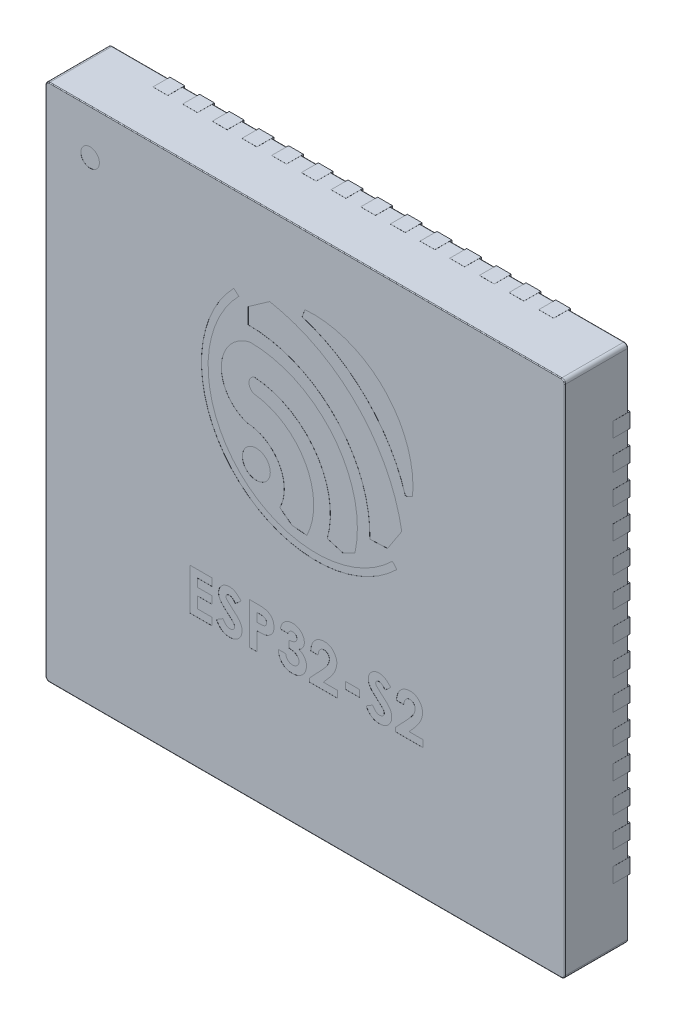
from build123d import *

# Parameters (mm, degrees)
SKETCH1_W                = 7
SKETCH1_H                = 7
BOSS_EXTRUDE1_DEPTH      = 0.85
FILLET1_R                = 0.05
FILLET2_R                = 0.01
BOSS_EXTRUDE2_DEPTH      = 0.025
BOSS_EXTRUDE2_DEPTH_BACK = 0.203
SKETCH2_W                = 0.2
SKETCH2_H                = 0.4
SKETCH2_W_2              = 0.4
SKETCH2_H_2              = 0.2
SKETCH3_R                = 0.125
SKETCH3_R_2              = 0.188076001
SKETCH3_W                = 0.193846154
SKETCH3_H                = 0.093333333
CUT_EXTRUDE1_DEPTH       = 0.001
BODY_MOVE_COPY1_ANGLE    = 180


with BuildPart() as part:
    # Sketch1 → Boss-Extrude1 (new body)
    with BuildSketch(Plane(origin=(0, 0, 0), x_dir=(1, 0, 0), z_dir=(0, 1, 0))):
        Rectangle(SKETCH1_W, SKETCH1_H)
    extrude(amount=BOSS_EXTRUDE1_DEPTH)

    # Fillet1
    fillet1_edges = [part.edges().sort_by_distance(p)[0] for p in [
        (3.5, 0.425, -3.5),
        (3.5, 0.425, 3.5),
        (-3.5, 0.425, 3.5),
        (-3.5, 0.425, -3.5),
    ]]
    fillet(fillet1_edges, radius=FILLET1_R)

    # Fillet2
    fillet2_edges = [part.edges().sort_by_distance(p)[0] for p in [
        (3.485355339, 0.85, 3.485355339),
        (0, 0.85, 3.5),
        (-3.485355339, 0.85, 3.485355339),
        (-3.5, 0.85, 0),
        (-3.485355339, 0.85, -3.485355339),
        (0, 0.85, -3.5),
        (3.485355339, 0.85, -3.485355339),
        (3.5, 0.85, 0),
        (3.5, 0, 0),
        (3.485355339, 0, -3.485355339),
        (0, 0, -3.5),
        (3.485355339, 0, 3.485355339),
        (0, 0, 3.5),
        (-3.485355339, 0, 3.485355339),
        (-3.5, 0, 0),
        (-3.485355339, 0, -3.485355339),
    ]]
    fillet(fillet2_edges, radius=FILLET2_R)

    # Sketch2 → Boss-Extrude2 (add, two sides: drawn at the far end of the back side and taken through both)
    with BuildSketch(Plane.XZ.offset(-BOSS_EXTRUDE2_DEPTH_BACK)):
        with BuildLine():
            Line((1.5, 2), (2, 1.5))
            Line((2, 1.5), (2, -1.875))
            ThreePointArc((2, -1.875), (1.963388348, -1.963388348), (1.875, -2))
            Line((1.875, -2), (-1.875, -2))
            ThreePointArc((-1.875, -2), (-1.963388348, -1.963388348), (-2, -1.875))
            Line((-2, -1.875), (-2, 1.875))
            ThreePointArc((-2, 1.875), (-1.963388348, 1.963388348), (-1.875, 2))
            Line((-1.875, 2), (1.5, 2))
        make_face()
        with Locations((-1.8, 3.301)):
            Rectangle(SKETCH2_W, SKETCH2_H)
        with Locations((-0.2, 3.301)):
            Rectangle(SKETCH2_W, SKETCH2_H)
        with Locations((-0.6, 3.301)):
            Rectangle(SKETCH2_W, SKETCH2_H)
        with Locations((-1, 3.301)):
            Rectangle(SKETCH2_W, SKETCH2_H)
        with Locations((-1.4, 3.301)):
            Rectangle(SKETCH2_W, SKETCH2_H)
        with Locations((-2.2, 3.301)):
            Rectangle(SKETCH2_W, SKETCH2_H)
        with Locations((-2.6, 3.301)):
            Rectangle(SKETCH2_W, SKETCH2_H)
        with Locations((2.6, 3.301)):
            Rectangle(SKETCH2_W, SKETCH2_H)
        with Locations((2.2, 3.301)):
            Rectangle(SKETCH2_W, SKETCH2_H)
        with Locations((1.8, 3.301)):
            Rectangle(SKETCH2_W, SKETCH2_H)
        with Locations((1.4, 3.301)):
            Rectangle(SKETCH2_W, SKETCH2_H)
        with Locations((1, 3.301)):
            Rectangle(SKETCH2_W, SKETCH2_H)
        with Locations((0.6, 3.301)):
            Rectangle(SKETCH2_W, SKETCH2_H)
        with Locations((0.2, 3.301)):
            Rectangle(SKETCH2_W, SKETCH2_H)
        with Locations((1.8, -3.301)):
            Rectangle(SKETCH2_W, SKETCH2_H)
        with Locations((0.2, -3.301)):
            Rectangle(SKETCH2_W, SKETCH2_H)
        with Locations((0.6, -3.301)):
            Rectangle(SKETCH2_W, SKETCH2_H)
        with Locations((1, -3.301)):
            Rectangle(SKETCH2_W, SKETCH2_H)
        with Locations((1.4, -3.301)):
            Rectangle(SKETCH2_W, SKETCH2_H)
        with Locations((2.2, -3.301)):
            Rectangle(SKETCH2_W, SKETCH2_H)
        with Locations((2.6, -3.301)):
            Rectangle(SKETCH2_W, SKETCH2_H)
        with Locations((-2.6, -3.301)):
            Rectangle(SKETCH2_W, SKETCH2_H)
        with Locations((-2.2, -3.301)):
            Rectangle(SKETCH2_W, SKETCH2_H)
        with Locations((-1.8, -3.301)):
            Rectangle(SKETCH2_W, SKETCH2_H)
        with Locations((-1.4, -3.301)):
            Rectangle(SKETCH2_W, SKETCH2_H)
        with Locations((-1, -3.301)):
            Rectangle(SKETCH2_W, SKETCH2_H)
        with Locations((-0.6, -3.301)):
            Rectangle(SKETCH2_W, SKETCH2_H)
        with Locations((-0.2, -3.301)):
            Rectangle(SKETCH2_W, SKETCH2_H)
        with Locations((3.301, 1.8)):
            Rectangle(SKETCH2_W_2, SKETCH2_H_2)
        with Locations((3.301, 0.2)):
            Rectangle(SKETCH2_W_2, SKETCH2_H_2)
        with Locations((3.301, 0.6)):
            Rectangle(SKETCH2_W_2, SKETCH2_H_2)
        with Locations((3.301, 1)):
            Rectangle(SKETCH2_W_2, SKETCH2_H_2)
        with Locations((3.301, 1.4)):
            Rectangle(SKETCH2_W_2, SKETCH2_H_2)
        with Locations((3.301, 2.2)):
            Rectangle(SKETCH2_W_2, SKETCH2_H_2)
        with Locations((3.301, 2.6)):
            Rectangle(SKETCH2_W_2, SKETCH2_H_2)
        with Locations((3.301, -2.6)):
            Rectangle(SKETCH2_W_2, SKETCH2_H_2)
        with Locations((3.301, -2.2)):
            Rectangle(SKETCH2_W_2, SKETCH2_H_2)
        with Locations((3.301, -1.8)):
            Rectangle(SKETCH2_W_2, SKETCH2_H_2)
        with Locations((3.301, -1.4)):
            Rectangle(SKETCH2_W_2, SKETCH2_H_2)
        with Locations((3.301, -1)):
            Rectangle(SKETCH2_W_2, SKETCH2_H_2)
        with Locations((3.301, -0.6)):
            Rectangle(SKETCH2_W_2, SKETCH2_H_2)
        with Locations((3.301, -0.2)):
            Rectangle(SKETCH2_W_2, SKETCH2_H_2)
        with Locations((-3.301, -1.8)):
            Rectangle(SKETCH2_W_2, SKETCH2_H_2)
        with Locations((-3.301, -0.2)):
            Rectangle(SKETCH2_W_2, SKETCH2_H_2)
        with Locations((-3.301, -0.6)):
            Rectangle(SKETCH2_W_2, SKETCH2_H_2)
        with Locations((-3.301, -1)):
            Rectangle(SKETCH2_W_2, SKETCH2_H_2)
        with Locations((-3.301, -1.4)):
            Rectangle(SKETCH2_W_2, SKETCH2_H_2)
        with Locations((-3.301, -2.2)):
            Rectangle(SKETCH2_W_2, SKETCH2_H_2)
        with Locations((-3.301, -2.6)):
            Rectangle(SKETCH2_W_2, SKETCH2_H_2)
        with Locations((-3.301, 2.6)):
            Rectangle(SKETCH2_W_2, SKETCH2_H_2)
        with Locations((-3.301, 2.2)):
            Rectangle(SKETCH2_W_2, SKETCH2_H_2)
        with Locations((-3.301, 1.8)):
            Rectangle(SKETCH2_W_2, SKETCH2_H_2)
        with Locations((-3.301, 1.4)):
            Rectangle(SKETCH2_W_2, SKETCH2_H_2)
        with Locations((-3.301, 1)):
            Rectangle(SKETCH2_W_2, SKETCH2_H_2)
        with Locations((-3.301, 0.6)):
            Rectangle(SKETCH2_W_2, SKETCH2_H_2)
        with Locations((-3.301, 0.2)):
            Rectangle(SKETCH2_W_2, SKETCH2_H_2)
    extrude(amount=BOSS_EXTRUDE2_DEPTH + BOSS_EXTRUDE2_DEPTH_BACK)

    # Sketch3 → Cut-Extrude1 (cut)
    # profile 1 of 14: a face of its own
    with BuildSketch(Plane(origin=(0, 0.85, 0), x_dir=(1, 0, 0), z_dir=(0, 1, 0))):
        with Locations((2.9, -2.9)):
            Circle(SKETCH3_R)
    # profile 2 of 14: a face of its own
    with BuildSketch(Plane(origin=(0, 0.85, 0), x_dir=(1, 0, 0), z_dir=(0, 1, 0))):
        with Locations((0.659982778, -0.439394297)):
            Circle(SKETCH3_R_2)
    # profile 3 of 14: a face of its own
    with BuildSketch(Plane(origin=(0, 0.85, 0), x_dir=(1, 0, 0), z_dir=(0, 1, 0))):
        with BuildLine():
            Line((-1.349549222, -1.072318121), (-1.446191222, -1.113478121))
            ThreePointArc((-1.446191222, -1.113478121), (-1.059880086, -2.180396862), (0.005032916, -2.572203181))
            Line((0.005032916, -2.572203181), (0.041868778, -2.469532121))
            ThreePointArc((0.041868778, -2.469532121), (-0.82803159, -1.944393898), (-1.349549222, -1.072318121))
        make_face()
    # profile 4 of 14: a face of its own
    with BuildSketch(Plane(origin=(0, 0.85, 0), x_dir=(1, 0, 0), z_dir=(0, 1, 0))):
        with BuildLine():
            Line((-0.869489223, -0.330470994), (-1.107671223, -0.340676994))
            Line((-1.107671223, -0.340676994), (-1.300157223, -0.634550994))
            ThreePointArc((-1.300157223, -0.634550994), (-0.692450735, -1.812086189), (0.480463515, -2.428664221))
            Line((0.480463515, -2.428664221), (0.769423515, -2.225930221))
            Line((0.769423515, -2.225930221), (0.769423515, -2.012948221))
            ThreePointArc((0.769423515, -2.012948221), (-0.40545634, -1.517930091), (-0.869489223, -0.330470994))
        make_face()
    # profile 5 of 14: a face of its own
    with BuildSketch(Plane(origin=(0, 0.85, 0), x_dir=(1, 0, 0), z_dir=(0, 1, 0))):
        with BuildLine():
            Line((0.896022778, -2.282632121), (0.963348778, -2.342188121))
            ThreePointArc((0.963348778, -2.342188121), (0.942387371, -0.165304228), (-1.234585284, -0.158029423))
            Line((-1.234585284, -0.158029423), (-1.174711499, -0.22508253))
            ThreePointArc((-1.174711499, -0.22508253), (0.879043915, -0.228943263), (0.896022778, -2.282632121))
        make_face()
    # profile 6 of 14: a face of its own
    with BuildSketch(Plane(origin=(0, 0.85, 0), x_dir=(1, 0, 0), z_dir=(0, 1, 0))):
        with BuildLine():
            Line((0.343768142, -0.092368262), (0.178036142, 0.033043738))
            Line((0.178036142, 0.033043738), (-0.020959858, 0.050557738))
            ThreePointArc((-0.020959858, 0.050557738), (-0.002822317, -0.781738392), (0.688714571, -1.245227928))
            ThreePointArc((0.688714571, -1.245227928), (0.759117615, -1.345326882), (0.684998991, -1.442706649))
            ThreePointArc((0.684998991, -1.442706649), (-0.138631273, -0.981739844), (-0.295638342, -0.051037964))
            Line((-0.295638342, -0.051037964), (-0.505974342, 0.011584036))
            Line((-0.505974342, 0.011584036), (-0.669841509, -0.070433453))
            ThreePointArc((-0.669841509, -0.070433453), (-0.380757465, -1.284591547), (0.745289658, -1.822891964))
            ThreePointArc((0.745289658, -1.822891964), (1.131651248, -1.357713211), (0.786573986, -0.861136696))
            ThreePointArc((0.786573986, -0.861136696), (0.353817857, -0.598490614), (0.343768142, -0.092368262))
        make_face()
    # profile 7 of 14: a face of its own
    with BuildSketch(Plane(origin=(0, 0.85, 0), x_dir=(1, 0, 0), z_dir=(0, 1, 0))):
        with BuildLine():
            Line((-1.329615385, 1.371666667), (-1.229102564, 1.371666667))
            add(Edge.make_bspline(
                [(-1.229102564, 1.371666667), (-1.229536493, 1.364063324), (-1.230384364, 1.349206849), (-1.233760681, 1.327628677), (-1.238273205, 1.307234689), (-1.244347173, 1.288086197), (-1.251828628, 1.270175155), (-1.260903774, 1.253560894), (-1.271301659, 1.238124364), (-1.283231873, 1.224136291), (-1.296210226, 1.211560588), (-1.310203445, 1.200566579), (-1.325171782, 1.191363155), (-1.341015146, 1.183813544), (-1.357671306, 1.177772883), (-1.37530855, 1.173736339), (-1.393771251, 1.17100216), (-1.406410578, 1.170762947), (-1.412852564, 1.170641026)],
                knots=[0, 0, 0, 0, 1.198928049, 2.342633425, 3.435730849, 4.486331048, 5.502589352, 6.488331875, 7.46361919, 8.428949135, 9.378681775, 10.305958057, 11.226249248, 12.140413166, 13.066341608, 14.010670971, 14.986082777, 16, 16, 16, 16], degree=3))
            add(Edge.make_bspline(
                [(-1.412852564, 1.170641026), (-1.420763388, 1.170871577), (-1.436213955, 1.171321865), (-1.458593158, 1.175657307), (-1.479626905, 1.182335589), (-1.499107339, 1.191940864), (-1.516932362, 1.204108445), (-1.532890071, 1.218771945), (-1.547053705, 1.235751496), (-1.558956337, 1.254922995), (-1.56863749, 1.27529442), (-1.575627503, 1.296236112), (-1.58016763, 1.317325828), (-1.580655213, 1.331521527), (-1.580897436, 1.338573718)],
                knots=[0, 0, 0, 0, 1.075206757, 2.099977874, 3.089436832, 4.070080219, 5.043757236, 6.01602434, 7.009399377, 8.042659726, 9.078134622, 10.07077983, 11.041594984, 12, 12, 12, 12], degree=3))
            add(Edge.make_bspline(
                [(-1.580897436, 1.338573718), (-1.580803484, 1.342839629), (-1.580614383, 1.351425853), (-1.579299535, 1.364418918), (-1.577327003, 1.377653874), (-1.574352904, 1.391119373), (-1.570643964, 1.404819191), (-1.566144468, 1.418794317), (-1.560750116, 1.432965562), (-1.554550661, 1.447492238), (-1.547155589, 1.462422243), (-1.538541381, 1.477976354), (-1.528470343, 1.49419737), (-1.517040798, 1.511034789), (-1.50433326, 1.52861919), (-1.490154305, 1.546742314), (-1.474685532, 1.565608767), (-1.463703291, 1.578217479), (-1.458060897, 1.584695513)],
                knots=[0, 0, 0, 0, 0.728286467, 1.465860763, 2.227952348, 3.011875114, 3.818782069, 4.650637576, 5.517456182, 6.406927181, 7.346324104, 8.360844784, 9.441645378, 10.605053135, 11.834886952, 13.145197974, 14.533275831, 16, 16, 16, 16], degree=3))
            Line((-1.458060897, 1.584695513), (-1.399615385, 1.651666667))
            Line((-1.399615385, 1.651666667), (-1.588076923, 1.651666667))
            Line((-1.588076923, 1.651666667), (-1.588076923, 1.745))
            Line((-1.588076923, 1.745), (-1.21474359, 1.745))
            Line((-1.21474359, 1.745), (-1.21474359, 1.694070513))
            Line((-1.21474359, 1.694070513), (-1.380544872, 1.517612179))
            add(Edge.make_bspline(
                [(-1.380544872, 1.517612179), (-1.385345321, 1.512464886), (-1.394642368, 1.502496106), (-1.407869872, 1.487855055), (-1.419844, 1.473964046), (-1.430297013, 1.46066199), (-1.439861346, 1.448399276), (-1.447862614, 1.436712327), (-1.454830739, 1.425930269), (-1.462109681, 1.412787369), (-1.469181366, 1.397230513), (-1.475665988, 1.379319453), (-1.479579191, 1.362188601), (-1.480123495, 1.351005785), (-1.480384615, 1.345641026)],
                knots=[0, 0, 0, 0, 1.246192343, 2.413505005, 3.49357156, 4.492416076, 5.408771964, 6.246246772, 6.999304986, 7.680960093, 8.904522682, 10.020616941, 11.0504258, 12, 12, 12, 12], degree=3))
            add(Edge.make_bspline(
                [(-1.480384615, 1.345641026), (-1.480192938, 1.340449305), (-1.479821532, 1.330389515), (-1.475638343, 1.316121148), (-1.469379259, 1.303104564), (-1.460292256, 1.291932704), (-1.449324476, 1.282672272), (-1.436578092, 1.275886338), (-1.42228714, 1.271897924), (-1.412279615, 1.2714066), (-1.40713141, 1.271153846)],
                knots=[0, 0, 0, 0, 1.061596218, 2.057012874, 3.024113775, 4.006148568, 4.986025304, 5.949989669, 6.945406325, 8, 8, 8, 8], degree=3))
            add(Edge.make_bspline(
                [(-1.40713141, 1.271153846), (-1.404472307, 1.271247897), (-1.399237434, 1.271433052), (-1.391542581, 1.272665578), (-1.384220376, 1.274837775), (-1.377189318, 1.277748215), (-1.370524444, 1.281606023), (-1.364242566, 1.286361386), (-1.358277496, 1.291893459), (-1.352656592, 1.298184945), (-1.347540836, 1.305206245), (-1.34299704, 1.312893234), (-1.339240077, 1.321241141), (-1.33593231, 1.33013976), (-1.333381202, 1.339684669), (-1.331523679, 1.349818744), (-1.330111528, 1.360525498), (-1.329783774, 1.367885385), (-1.329615385, 1.371666667)],
                knots=[0, 0, 0, 0, 0.903469896, 1.778625579, 2.63899355, 3.493148037, 4.358286772, 5.247621495, 6.164656832, 7.118446693, 8.109501108, 9.111810964, 10.146451449, 11.215617525, 12.33435995, 13.498009769, 14.714554818, 16, 16, 16, 16], degree=3))
        make_face()
    # profile 8 of 14: a face of its own
    with BuildSketch(Plane(origin=(0, 0.85, 0), x_dir=(1, 0, 0), z_dir=(0, 1, 0))):
        with BuildLine():
            Line((-1.150128205, 1.259823718), (-1.074967949, 1.328589744))
            add(Edge.make_bspline(
                [(-1.074967949, 1.328589744), (-1.071749025, 1.324047432), (-1.065569141, 1.315326827), (-1.055542124, 1.303662479), (-1.045575011, 1.293646645), (-1.035464015, 1.285565689), (-1.025383215, 1.279060264), (-1.015118439, 1.274573211), (-1.004787777, 1.27168756), (-0.997843521, 1.271329977), (-0.994423077, 1.271153846)],
                knots=[0, 0, 0, 0, 1.299459705, 2.494781419, 3.587730629, 4.594196874, 5.512431013, 6.380462003, 7.202284646, 8, 8, 8, 8], degree=3))
            add(Edge.make_bspline(
                [(-0.994423077, 1.271153846), (-0.991231278, 1.271262401), (-0.985068752, 1.271471991), (-0.976324536, 1.273660135), (-0.96846638, 1.277196059), (-0.961703605, 1.282080374), (-0.956263099, 1.287913663), (-0.952032781, 1.294123483), (-0.949574535, 1.300894233), (-0.949258848, 1.305537731), (-0.949102564, 1.307836538)],
                knots=[0, 0, 0, 0, 1.184157716, 2.286297433, 3.324836695, 4.370048774, 5.362957217, 6.276446515, 7.146738784, 8, 8, 8, 8], degree=3))
            add(Edge.make_bspline(
                [(-0.949102564, 1.307836538), (-0.949201492, 1.310167416), (-0.949400718, 1.314861481), (-0.951324973, 1.321741217), (-0.954225375, 1.32846352), (-0.956996827, 1.332555705), (-0.958413462, 1.334647436)],
                knots=[0, 0, 0, 0, 0.967525499, 1.948461899, 2.951351359, 4, 4, 4, 4], degree=3))
            add(Edge.make_bspline(
                [(-0.958413462, 1.334647436), (-0.959706529, 1.336268479), (-0.962700198, 1.340021467), (-0.968235031, 1.346060545), (-0.975472159, 1.353150087), (-0.984105696, 1.361647315), (-0.994459644, 1.371222165), (-1.006311699, 1.382151867), (-1.019925554, 1.394065148), (-1.02946345, 1.402475381), (-1.034471154, 1.406891026)],
                knots=[0, 0, 0, 0, 0.473849886, 1.097042329, 1.870584189, 2.789244661, 3.865562256, 5.093556389, 6.47402294, 8, 8, 8, 8], degree=3))
            add(Edge.make_bspline(
                [(-1.034471154, 1.406891026), (-1.039182868, 1.410966692), (-1.048124722, 1.41870146), (-1.06083108, 1.429697774), (-1.072070558, 1.439546488), (-1.081740938, 1.448321352), (-1.090131193, 1.455661006), (-1.096870242, 1.462016995), (-1.102246501, 1.467111273), (-1.105299587, 1.470191745), (-1.106602564, 1.47150641)],
                knots=[0, 0, 0, 0, 1.543627419, 2.929484142, 4.163674036, 5.24627963, 6.164986907, 6.925413438, 7.541394495, 8, 8, 8, 8], degree=3))
            add(Edge.make_bspline(
                [(-1.106602564, 1.47150641), (-1.111548836, 1.476855134), (-1.121057308, 1.48713726), (-1.133390745, 1.503114456), (-1.143650973, 1.518590879), (-1.151596469, 1.53400356), (-1.157358894, 1.549671015), (-1.161553735, 1.56581678), (-1.164068137, 1.582671707), (-1.164346424, 1.594147543), (-1.164487179, 1.599951923)],
                knots=[0, 0, 0, 0, 1.206413378, 2.319150186, 3.339784753, 4.27899982, 5.184598145, 6.099639703, 7.038813909, 8, 8, 8, 8], degree=3))
            add(Edge.make_bspline(
                [(-1.164487179, 1.599951923), (-1.16438687, 1.605607626), (-1.16419006, 1.616704326), (-1.161782121, 1.632943448), (-1.158343634, 1.648482109), (-1.15304533, 1.663164645), (-1.146533298, 1.677165054), (-1.138596701, 1.690488046), (-1.128893418, 1.702822581), (-1.118115899, 1.714501479), (-1.106008493, 1.724984508), (-1.092989133, 1.73422665), (-1.079033025, 1.742030022), (-1.064246525, 1.748460805), (-1.048444187, 1.753233156), (-1.031875648, 1.756841331), (-1.014373974, 1.759016891), (-1.002431403, 1.759243304), (-0.996330128, 1.759358974)],
                knots=[0, 0, 0, 0, 1.043039441, 2.046482205, 3.024244422, 3.976033659, 4.920890471, 5.871402525, 6.830893638, 7.812473116, 8.800703348, 9.781190227, 10.754606487, 11.746997808, 12.751247331, 13.796362838, 14.874195872, 16, 16, 16, 16], degree=3))
            add(Edge.make_bspline(
                [(-0.996330128, 1.759358974), (-0.991540609, 1.759274098), (-0.982054614, 1.759105993), (-0.968074352, 1.757730742), (-0.954572299, 1.755518228), (-0.941575423, 1.752322605), (-0.929001509, 1.748365885), (-0.916987014, 1.743220735), (-0.905372197, 1.73740225), (-0.894195684, 1.730659569), (-0.883550088, 1.722828599), (-0.873128691, 1.714218424), (-0.863300942, 1.704356812), (-0.853691349, 1.693603273), (-0.844701255, 1.681646143), (-0.835856932, 1.668845223), (-0.827590046, 1.654894499), (-0.822481253, 1.645109923), (-0.819871795, 1.640112179)],
                knots=[0, 0, 0, 0, 1.017088714, 2.014418954, 2.980620591, 3.920647918, 4.854987948, 5.776890852, 6.693269322, 7.612671471, 8.545186947, 9.498010697, 10.480815007, 11.499174288, 12.558697099, 13.655746277, 14.802607237, 16, 16, 16, 16], degree=3))
            Line((-0.819871795, 1.640112179), (-0.908269231, 1.587051282))
            add(Edge.make_bspline(
                [(-0.908269231, 1.587051282), (-0.91153304, 1.592724564), (-0.917790043, 1.603600731), (-0.928393118, 1.61821424), (-0.939255427, 1.630728291), (-0.950628097, 1.640921698), (-0.96237284, 1.64893076), (-0.974546387, 1.654654591), (-0.98715729, 1.658197636), (-0.995747264, 1.658630324), (-1.000032051, 1.658846154)],
                knots=[0, 0, 0, 0, 1.283663364, 2.460892379, 3.537111102, 4.529833553, 5.449777664, 6.316464042, 7.160231139, 8, 8, 8, 8], degree=3))
            add(Edge.make_bspline(
                [(-1.000032051, 1.658846154), (-1.004391096, 1.65867157), (-1.012848277, 1.658332853), (-1.024939693, 1.655142476), (-1.036074146, 1.650245668), (-1.045646949, 1.643124015), (-1.053776098, 1.635003258), (-1.059603863, 1.625844323), (-1.06338413, 1.616053536), (-1.063776846, 1.609221419), (-1.063974359, 1.605785256)],
                knots=[0, 0, 0, 0, 1.13537643, 2.202795631, 3.242191317, 4.290390765, 5.297919085, 6.223733717, 7.106639842, 8, 8, 8, 8], degree=3))
            add(Edge.make_bspline(
                [(-1.063974359, 1.605785256), (-1.063789481, 1.60259007), (-1.063413918, 1.596099356), (-1.060662697, 1.586443104), (-1.056325607, 1.576833675), (-1.051348288, 1.568868342), (-1.046159164, 1.562228906), (-1.041072828, 1.556562636), (-1.035044641, 1.55017142), (-1.027921, 1.543229538), (-1.01984046, 1.535603522), (-1.010776565, 1.527311501), (-1.000631708, 1.51842107), (-0.993461014, 1.512365243), (-0.989711538, 1.509198718)],
                knots=[0, 0, 0, 0, 0.916057066, 1.860882232, 2.859899639, 3.934694552, 4.546382938, 5.276161949, 6.118633209, 7.067046139, 8.129668089, 9.306861125, 10.591787583, 12, 12, 12, 12], degree=3))
            add(Edge.make_bspline(
                [(-0.989711538, 1.509198718), (-0.982583902, 1.503167658), (-0.968903811, 1.49159223), (-0.949568655, 1.474499071), (-0.932158077, 1.45851205), (-0.916788193, 1.443503271), (-0.903413348, 1.42956863), (-0.891886302, 1.416830459), (-0.882393328, 1.405038965), (-0.872549695, 1.390955421), (-0.862932178, 1.374035709), (-0.854758657, 1.35358371), (-0.849476246, 1.333157319), (-0.848882152, 1.319421115), (-0.848589744, 1.312660256)],
                knots=[0, 0, 0, 0, 1.345685333, 2.582777463, 3.719355561, 4.752181389, 5.678433858, 6.502864483, 7.227563063, 7.858499643, 8.978226409, 10.023061349, 11.026965269, 12, 12, 12, 12], degree=3))
            add(Edge.make_bspline(
                [(-0.848589744, 1.312660256), (-0.848711413, 1.307865931), (-0.848951115, 1.298420595), (-0.851082959, 1.284530977), (-0.8542839, 1.271134996), (-0.858883849, 1.258236044), (-0.865053641, 1.245979431), (-0.872341296, 1.234166784), (-0.880954327, 1.222834207), (-0.890825775, 1.21223309), (-0.901661908, 1.202487997), (-0.913219698, 1.193938221), (-0.92539236, 1.186708558), (-0.938216808, 1.18081886), (-0.951670349, 1.17622284), (-0.965765408, 1.172974759), (-0.980458793, 1.1710378), (-0.990453528, 1.170774931), (-0.995544872, 1.170641026)],
                knots=[0, 0, 0, 0, 1.010806554, 1.991397492, 2.957573065, 3.913225829, 4.872777376, 5.846906201, 6.837692339, 7.870332167, 8.898170327, 9.907899016, 10.8981826, 11.879407896, 12.8797257, 13.891947133, 14.926152479, 16, 16, 16, 16], degree=3))
            add(Edge.make_bspline(
                [(-0.995544872, 1.170641026), (-1.00214261, 1.170883042), (-1.015286007, 1.171365165), (-1.034724651, 1.175115545), (-1.053720853, 1.181075637), (-1.069075753, 1.188096356), (-1.08118825, 1.19511415), (-1.090493914, 1.201444158), (-1.100036773, 1.20871318), (-1.109641636, 1.217132748), (-1.119672723, 1.22621616), (-1.129623355, 1.236586776), (-1.139980803, 1.247713237), (-1.146686482, 1.255716172), (-1.150128205, 1.259823718)],
                knots=[0, 0, 0, 0, 1.282890948, 2.555655204, 3.837225328, 5.149160694, 5.83044799, 6.558852598, 7.337307105, 8.162686284, 9.043076448, 9.969084596, 10.957622644, 12, 12, 12, 12], degree=3))
        make_face()
    # profile 9 of 14: a face of its own
    with BuildSketch(Plane(origin=(0, 0.85, 0), x_dir=(1, 0, 0), z_dir=(0, 1, 0))):
        with Locations((-0.636794872, 1.540384616)):
            Rectangle(SKETCH3_W, SKETCH3_H)
    # profile 10 of 14: a face of its own
    with BuildSketch(Plane(origin=(0, 0.85, 0), x_dir=(1, 0, 0), z_dir=(0, 1, 0))):
        with BuildLine():
            Line((-0.173717949, 1.371666667), (-0.073205128, 1.371666667))
            add(Edge.make_bspline(
                [(-0.073205128, 1.371666667), (-0.073639057, 1.364063324), (-0.074486928, 1.349206849), (-0.077863245, 1.327628677), (-0.082375769, 1.307234689), (-0.088449737, 1.288086197), (-0.095931192, 1.270175155), (-0.105006338, 1.253560894), (-0.115404223, 1.238124364), (-0.127334437, 1.224136291), (-0.14031279, 1.211560588), (-0.15430601, 1.200566579), (-0.169274346, 1.191363155), (-0.18511771, 1.183813544), (-0.20177387, 1.177772883), (-0.219411114, 1.173736339), (-0.237873816, 1.17100216), (-0.250513142, 1.170762947), (-0.256955128, 1.170641026)],
                knots=[0, 0, 0, 0, 1.198928049, 2.342633425, 3.435730849, 4.486331048, 5.502589352, 6.488331875, 7.46361919, 8.428949135, 9.378681775, 10.305958057, 11.226249248, 12.140413166, 13.066341608, 14.010670971, 14.986082777, 16, 16, 16, 16], degree=3))
            add(Edge.make_bspline(
                [(-0.256955128, 1.170641026), (-0.264865952, 1.170871577), (-0.280316519, 1.171321865), (-0.302695722, 1.175657307), (-0.323729469, 1.182335589), (-0.343209904, 1.191940864), (-0.361034926, 1.204108445), (-0.376992635, 1.218771945), (-0.391156269, 1.235751496), (-0.403058901, 1.254922995), (-0.412740054, 1.27529442), (-0.419730067, 1.296236112), (-0.424270194, 1.317325828), (-0.424757777, 1.331521527), (-0.425, 1.338573718)],
                knots=[0, 0, 0, 0, 1.075206757, 2.099977874, 3.089436832, 4.070080219, 5.043757236, 6.01602434, 7.009399377, 8.042659726, 9.078134622, 10.07077983, 11.041594984, 12, 12, 12, 12], degree=3))
            add(Edge.make_bspline(
                [(-0.425, 1.338573718), (-0.424906048, 1.342839629), (-0.424716947, 1.351425853), (-0.423402099, 1.364418918), (-0.421429567, 1.377653874), (-0.418455469, 1.391119373), (-0.414746528, 1.404819191), (-0.410247032, 1.418794317), (-0.40485268, 1.432965562), (-0.398653225, 1.447492238), (-0.391258153, 1.462422243), (-0.382643945, 1.477976354), (-0.372572907, 1.49419737), (-0.361143362, 1.511034789), (-0.348435824, 1.52861919), (-0.334256869, 1.546742314), (-0.318788096, 1.565608767), (-0.307805855, 1.578217479), (-0.302163462, 1.584695513)],
                knots=[0, 0, 0, 0, 0.728286467, 1.465860763, 2.227952348, 3.011875114, 3.818782069, 4.650637576, 5.517456182, 6.406927181, 7.346324104, 8.360844784, 9.441645378, 10.605053135, 11.834886952, 13.145197974, 14.533275831, 16, 16, 16, 16], degree=3))
            Line((-0.302163462, 1.584695513), (-0.243717949, 1.651666667))
            Line((-0.243717949, 1.651666667), (-0.432179487, 1.651666667))
            Line((-0.432179487, 1.651666667), (-0.432179487, 1.745))
            Line((-0.432179487, 1.745), (-0.058846154, 1.745))
            Line((-0.058846154, 1.745), (-0.058846154, 1.694070513))
            Line((-0.058846154, 1.694070513), (-0.224647436, 1.517612179))
            add(Edge.make_bspline(
                [(-0.224647436, 1.517612179), (-0.229447885, 1.512464886), (-0.238744932, 1.502496106), (-0.251972436, 1.487855055), (-0.263946564, 1.473964046), (-0.274399577, 1.46066199), (-0.28396391, 1.448399276), (-0.291965178, 1.436712327), (-0.298933303, 1.425930269), (-0.306212245, 1.412787369), (-0.31328393, 1.397230513), (-0.319768552, 1.379319453), (-0.323681755, 1.362188601), (-0.324226059, 1.351005785), (-0.324487179, 1.345641026)],
                knots=[0, 0, 0, 0, 1.246192343, 2.413505005, 3.49357156, 4.492416076, 5.408771964, 6.246246772, 6.999304986, 7.680960093, 8.904522682, 10.020616941, 11.0504258, 12, 12, 12, 12], degree=3))
            add(Edge.make_bspline(
                [(-0.324487179, 1.345641026), (-0.324295502, 1.340449305), (-0.323924096, 1.330389515), (-0.319740907, 1.316121148), (-0.313481823, 1.303104564), (-0.30439482, 1.291932704), (-0.29342704, 1.282672272), (-0.280680656, 1.275886338), (-0.266389704, 1.271897924), (-0.256382179, 1.2714066), (-0.251233974, 1.271153846)],
                knots=[0, 0, 0, 0, 1.061596218, 2.057012874, 3.024113775, 4.006148568, 4.986025304, 5.949989669, 6.945406325, 8, 8, 8, 8], degree=3))
            add(Edge.make_bspline(
                [(-0.251233974, 1.271153846), (-0.248574871, 1.271247897), (-0.243339999, 1.271433052), (-0.235645145, 1.272665578), (-0.22832294, 1.274837775), (-0.221291882, 1.277748215), (-0.214627008, 1.281606023), (-0.20834513, 1.286361386), (-0.20238006, 1.291893459), (-0.196759156, 1.298184945), (-0.1916434, 1.305206245), (-0.187099604, 1.312893234), (-0.183342641, 1.321241141), (-0.180034874, 1.33013976), (-0.177483766, 1.339684669), (-0.175626243, 1.349818744), (-0.174214093, 1.360525498), (-0.173886339, 1.367885385), (-0.173717949, 1.371666667)],
                knots=[0, 0, 0, 0, 0.903469896, 1.778625579, 2.63899355, 3.493148037, 4.358286772, 5.247621495, 6.164656832, 7.118446693, 8.109501108, 9.111810964, 10.146451449, 11.215617525, 12.33435995, 13.498009769, 14.714554818, 16, 16, 16, 16], degree=3))
        make_face()
    # profile 11 of 14: a face of its own
    with BuildSketch(Plane(origin=(0, 0.85, 0), x_dir=(1, 0, 0), z_dir=(0, 1, 0))):
        with BuildLine():
            Line((0.235512821, 1.321410256), (0.336025641, 1.321410256))
            add(Edge.make_bspline(
                [(0.336025641, 1.321410256), (0.335320409, 1.31638488), (0.333942917, 1.306569075), (0.330556663, 1.29232424), (0.326640665, 1.278778454), (0.321632658, 1.266004411), (0.315851817, 1.254015882), (0.309110572, 1.242802139), (0.301721721, 1.232202256), (0.295936713, 1.225850074), (0.293060897, 1.222692308)],
                knots=[0, 0, 0, 0, 1.1115466, 2.171125598, 3.205689823, 4.19946166, 5.17440286, 6.118867946, 7.064860634, 8, 8, 8, 8], degree=3))
            add(Edge.make_bspline(
                [(0.293060897, 1.222692308), (0.288923144, 1.218519423), (0.280768068, 1.210295105), (0.267139979, 1.199760662), (0.252855224, 1.190643818), (0.237627318, 1.183415918), (0.221693217, 1.17756577), (0.204926208, 1.173636213), (0.187394808, 1.171028917), (0.175431832, 1.170772089), (0.169326923, 1.170641026)],
                knots=[0, 0, 0, 0, 1.01925491, 2.00884431, 2.983262333, 3.955970413, 4.92937149, 5.924503185, 6.940838805, 8, 8, 8, 8], degree=3))
            add(Edge.make_bspline(
                [(0.169326923, 1.170641026), (0.163899345, 1.17076916), (0.15322982, 1.171021047), (0.137548302, 1.173043056), (0.122597288, 1.176589434), (0.10821874, 1.181226244), (0.094624119, 1.187535399), (0.08151338, 1.194858985), (0.069252837, 1.203841667), (0.057813803, 1.213991195), (0.047304869, 1.224968902), (0.038204085, 1.236703169), (0.030379978, 1.248880545), (0.023933949, 1.261602201), (0.018977829, 1.274889666), (0.015538134, 1.288666177), (0.01328677, 1.302901337), (0.013062476, 1.312576783), (0.012948718, 1.317483974)],
                knots=[0, 0, 0, 0, 1.091422571, 2.145516843, 3.172569842, 4.178562979, 5.178154469, 6.181868002, 7.194278174, 8.227918432, 9.254613415, 10.245994977, 11.209837596, 12.161663635, 13.10878368, 14.055455738, 15.013766427, 16, 16, 16, 16], degree=3))
            add(Edge.make_bspline(
                [(0.012948718, 1.317483974), (0.01318665, 1.323560043), (0.013656501, 1.335558597), (0.017372329, 1.35308482), (0.023345734, 1.369804956), (0.031839031, 1.385520895), (0.042504756, 1.400216266), (0.055584247, 1.413377824), (0.070712507, 1.425209401), (0.082069177, 1.431567771), (0.087884615, 1.434823718)],
                knots=[0, 0, 0, 0, 0.992776698, 1.96045919, 2.915875678, 3.886951799, 4.871409521, 5.874469288, 6.911574252, 8, 8, 8, 8], degree=3))
            add(Edge.make_bspline(
                [(0.087884615, 1.434823718), (0.083892839, 1.436134086), (0.076049176, 1.438708901), (0.064902601, 1.443783103), (0.054294758, 1.44931658), (0.044468244, 1.455776324), (0.035153591, 1.462714593), (0.026645501, 1.470504437), (0.018723661, 1.478945903), (0.011584047, 1.488128793), (0.005200901, 1.497900429), (-0.000424504, 1.50808518), (-0.005145275, 1.518720269), (-0.009107395, 1.529727542), (-0.012130383, 1.541215331), (-0.014257164, 1.553144704), (-0.015486896, 1.565486917), (-0.015674414, 1.573848817), (-0.015769231, 1.578076923)],
                knots=[0, 0, 0, 0, 1.059375415, 2.081625174, 3.086260357, 4.075579879, 5.045586876, 6.014170127, 6.982201689, 7.963705737, 8.945119069, 9.924852636, 10.896327119, 11.878239286, 12.873838556, 13.889973282, 14.933087432, 16, 16, 16, 16], degree=3))
            add(Edge.make_bspline(
                [(-0.015769231, 1.578076923), (-0.015593473, 1.584293248), (-0.015246769, 1.596555783), (-0.012600271, 1.614558426), (-0.008349553, 1.631814742), (-0.002377408, 1.648346481), (0.005442003, 1.664103997), (0.014886251, 1.67919325), (0.02607072, 1.693495675), (0.038825832, 1.706884554), (0.052872225, 1.719171723), (0.068003649, 1.730017034), (0.084229604, 1.738959927), (0.101163049, 1.746603029), (0.11918405, 1.752275589), (0.13805987, 1.756429633), (0.157928244, 1.758957092), (0.171488263, 1.759223115), (0.178413462, 1.759358974)],
                knots=[0, 0, 0, 0, 1.005301618, 1.9830924, 2.936709333, 3.876255674, 4.820386332, 5.77704884, 6.75110905, 7.752325838, 8.764085485, 9.766124222, 10.757295257, 11.756573224, 12.766631673, 13.80722022, 14.880131728, 16, 16, 16, 16], degree=3))
            add(Edge.make_bspline(
                [(0.178413462, 1.759358974), (0.184964748, 1.759216098), (0.197774922, 1.758936721), (0.216512121, 1.756517437), (0.234321426, 1.752617633), (0.2512419, 1.747111183), (0.267201504, 1.740016724), (0.282293221, 1.731453593), (0.296352293, 1.721159416), (0.309443449, 1.709377071), (0.321455703, 1.696340051), (0.331924853, 1.68194209), (0.341035772, 1.666497797), (0.348848592, 1.649973957), (0.354952918, 1.632223135), (0.359807526, 1.613403851), (0.363187305, 1.59343473), (0.364218054, 1.579696731), (0.36474359, 1.572692308)],
                knots=[0, 0, 0, 0, 1.066693477, 2.085777942, 3.071407889, 4.032495163, 4.978645371, 5.911608997, 6.853298848, 7.810770565, 8.776420673, 9.735131334, 10.704462168, 11.693492242, 12.70668109, 13.756973703, 14.856375978, 16, 16, 16, 16], degree=3))
            Line((0.36474359, 1.572692308), (0.264230769, 1.572692308))
            add(Edge.make_bspline(
                [(0.264230769, 1.572692308), (0.263593706, 1.576214216), (0.262352858, 1.583074056), (0.259934848, 1.593006556), (0.256775556, 1.602171259), (0.253163548, 1.610635496), (0.24917005, 1.618486133), (0.244398511, 1.625513229), (0.239282364, 1.631992951), (0.231591628, 1.639440955), (0.220861289, 1.647251761), (0.206333042, 1.654169369), (0.190098017, 1.658103673), (0.178771143, 1.658593157), (0.172916667, 1.658846154)],
                knots=[0, 0, 0, 0, 0.928450228, 1.808400301, 2.64896863, 3.43999153, 4.194978884, 4.9294959, 5.640047715, 6.332896648, 7.70085756, 9.063442004, 10.482192841, 12, 12, 12, 12], degree=3))
            add(Edge.make_bspline(
                [(0.172916667, 1.658846154), (0.169809597, 1.658792688), (0.163723541, 1.658687961), (0.154782564, 1.657533761), (0.146270639, 1.655619089), (0.138098852, 1.653049077), (0.130378665, 1.649660046), (0.12301138, 1.645629814), (0.116128088, 1.640730342), (0.109707105, 1.635205485), (0.103896062, 1.629121647), (0.098640292, 1.622766676), (0.094422023, 1.615880904), (0.090920515, 1.608736641), (0.088032192, 1.601335735), (0.086220065, 1.593509792), (0.084863356, 1.58541567), (0.08478391, 1.57987786), (0.08474359, 1.577067308)],
                knots=[0, 0, 0, 0, 1.110416125, 2.175056767, 3.216269732, 4.226816172, 5.232753079, 6.226173397, 7.223992381, 8.247806573, 9.250094092, 10.229378924, 11.190237183, 12.128982156, 13.072570213, 14.022671385, 14.996464856, 16, 16, 16, 16], degree=3))
            add(Edge.make_bspline(
                [(0.08474359, 1.577067308), (0.084845967, 1.573992444), (0.085048552, 1.567907875), (0.086831287, 1.55899123), (0.08949978, 1.550380922), (0.093337568, 1.542147992), (0.098359484, 1.53434086), (0.104465618, 1.526894865), (0.11171121, 1.519869291), (0.119853622, 1.513059525), (0.129221388, 1.507098287), (0.139436221, 1.501608879), (0.150749774, 1.497237957), (0.162890632, 1.493334868), (0.176087072, 1.490483874), (0.190257547, 1.488413844), (0.205379082, 1.486873006), (0.215802557, 1.48665195), (0.221153846, 1.486538462)],
                knots=[0, 0, 0, 0, 0.809868251, 1.602574917, 2.388262527, 3.182133002, 3.988875265, 4.829537611, 5.714850619, 6.646378958, 7.622533229, 8.636771727, 9.698525113, 10.814716514, 11.996253919, 13.252421425, 14.589425562, 16, 16, 16, 16], degree=3))
            Line((0.221153846, 1.486538462), (0.221153846, 1.393205128))
            add(Edge.make_bspline(
                [(0.221153846, 1.393205128), (0.214490505, 1.392639313), (0.202024712, 1.391580786), (0.184731314, 1.389079115), (0.170095108, 1.385808292), (0.157958764, 1.381618366), (0.147730548, 1.376701252), (0.139022871, 1.370867557), (0.131270872, 1.364408107), (0.124941917, 1.356988747), (0.119827539, 1.349156802), (0.116206182, 1.340933841), (0.113802284, 1.332502667), (0.113574437, 1.326735729), (0.113461538, 1.323878205)],
                knots=[0, 0, 0, 0, 1.700278244, 3.18088388, 4.44026007, 5.507838349, 6.439172496, 7.317391478, 8.167251366, 8.996486918, 9.787781501, 10.536992524, 11.275078289, 12, 12, 12, 12], degree=3))
            add(Edge.make_bspline(
                [(0.113461538, 1.323878205), (0.113651828, 1.320229987), (0.114023234, 1.313109438), (0.117041831, 1.302943573), (0.121946199, 1.293731269), (0.128851421, 1.285790118), (0.137300117, 1.279233465), (0.147142458, 1.274454531), (0.158211569, 1.271595999), (0.165981529, 1.271304568), (0.17, 1.271153846)],
                knots=[0, 0, 0, 0, 1.008776249, 1.968917671, 2.909425455, 3.878736958, 4.86052431, 5.85160606, 6.888892716, 8, 8, 8, 8], degree=3))
            add(Edge.make_bspline(
                [(0.17, 1.271153846), (0.173642115, 1.271332707), (0.180869186, 1.271687623), (0.191433061, 1.274348407), (0.201453666, 1.278782228), (0.210674015, 1.285008571), (0.219071432, 1.292409334), (0.226112495, 1.301103458), (0.231844356, 1.310750882), (0.234285205, 1.317843202), (0.235512821, 1.321410256)],
                knots=[0, 0, 0, 0, 0.988439209, 1.961366134, 2.938893463, 3.950078543, 4.971412263, 5.967491143, 6.977757845, 8, 8, 8, 8], degree=3))
        make_face()
    # profile 12 of 14: a face of its own
    with BuildSketch(Plane(origin=(0, 0.85, 0), x_dir=(1, 0, 0), z_dir=(0, 1, 0))):
        with BuildLine():
            Line((0.752435897, 1.185), (0.64025641, 1.185))
            add(Edge.make_bspline(
                [(0.64025641, 1.185), (0.632926748, 1.185032809), (0.618786293, 1.185096105), (0.598394595, 1.18586365), (0.579582252, 1.187239134), (0.562353598, 1.188939025), (0.54671568, 1.191322169), (0.532649035, 1.194054374), (0.520150359, 1.197382611), (0.509079945, 1.201334407), (0.499141542, 1.205989345), (0.489747658, 1.210961333), (0.481039678, 1.216854856), (0.472813162, 1.223245097), (0.46513034, 1.230264998), (0.457934281, 1.237886816), (0.451299085, 1.246221317), (0.445266349, 1.255211085), (0.439790721, 1.264673094), (0.435007643, 1.274628922), (0.431127674, 1.285093055), (0.42787292, 1.295998144), (0.425258654, 1.30734362), (0.42351852, 1.319199285), (0.422336532, 1.33148235), (0.422232238, 1.339842213), (0.422179487, 1.344070513)],
                knots=[0, 0, 0, 0, 1.698787518, 3.27731721, 4.728409951, 6.070286353, 7.288646904, 8.393455548, 9.389990496, 10.283725379, 11.113616976, 11.931887102, 12.744353494, 13.547053751, 14.344590688, 15.153907614, 15.974148981, 16.810666655, 17.660988447, 18.506082349, 19.367288142, 20.244738011, 21.142497992, 22.06302001, 23.020302899, 24, 24, 24, 24], degree=3))
            add(Edge.make_bspline(
                [(0.422179487, 1.344070513), (0.42225548, 1.348748316), (0.422404814, 1.357940775), (0.423879835, 1.371413481), (0.42637475, 1.38426723), (0.429714743, 1.396556933), (0.434071299, 1.408255703), (0.439531521, 1.419286688), (0.445777267, 1.429788116), (0.453150619, 1.439567914), (0.461298196, 1.448675865), (0.470071275, 1.457211087), (0.479733095, 1.464822767), (0.489938796, 1.471906626), (0.500980392, 1.478046871), (0.512530741, 1.483732482), (0.524882794, 1.488557244), (0.533478534, 1.491088472), (0.537836538, 1.492371795)],
                knots=[0, 0, 0, 0, 1.101767505, 2.165108537, 3.187936629, 4.183892551, 5.162396277, 6.123736501, 7.080098904, 8.036826416, 9.0040019, 9.957275584, 10.916231297, 11.898534744, 12.880877694, 13.889532316, 14.930001539, 16, 16, 16, 16], degree=3))
            add(Edge.make_bspline(
                [(0.537836538, 1.492371795), (0.540707294, 1.493086043), (0.546926274, 1.494633336), (0.557216979, 1.496204226), (0.569075936, 1.497648563), (0.582541492, 1.498889796), (0.597621411, 1.499733545), (0.614301092, 1.500392475), (0.632588094, 1.500871586), (0.645304152, 1.500888587), (0.651923077, 1.500897436)],
                knots=[0, 0, 0, 0, 0.618981996, 1.340914327, 2.176866532, 3.120127938, 4.170906482, 5.338178032, 6.614476169, 8, 8, 8, 8], degree=3))
            Line((0.651923077, 1.500897436), (0.651923077, 1.745))
            Line((0.651923077, 1.745), (0.752435897, 1.745))
            Line((0.752435897, 1.745), (0.752435897, 1.185))
        make_face()
        with BuildLine():
            Line((0.651923077, 1.400384615), (0.616362179, 1.400384615))
            add(Edge.make_bspline(
                [(0.616362179, 1.400384615), (0.609891207, 1.400343738), (0.597984522, 1.400268522), (0.581725663, 1.399175063), (0.568655446, 1.397512576), (0.55834107, 1.395108722), (0.550193752, 1.391529377), (0.543251393, 1.387212316), (0.537083541, 1.382024585), (0.531942152, 1.375805303), (0.527752416, 1.368866564), (0.524813785, 1.361155974), (0.522959047, 1.352796757), (0.522782896, 1.346959973), (0.522692308, 1.343958333)],
                knots=[0, 0, 0, 0, 1.862351722, 3.426754836, 4.68713255, 5.653025869, 6.462861518, 7.236406327, 7.999926698, 8.771672214, 9.54880311, 10.322347919, 11.137246204, 12, 12, 12, 12], degree=3))
            add(Edge.make_bspline(
                [(0.522692308, 1.343958333), (0.522780071, 1.341335184), (0.522950353, 1.336245644), (0.524218528, 1.328905341), (0.526186802, 1.322076085), (0.529194926, 1.315853074), (0.532847062, 1.310091161), (0.537480252, 1.304969718), (0.542823271, 1.300323046), (0.546955249, 1.297866587), (0.549054487, 1.29661859)],
                knots=[0, 0, 0, 0, 1.102449765, 2.139017612, 3.12397484, 4.080535277, 5.035673127, 5.982361139, 6.974944601, 8, 8, 8, 8], degree=3))
            add(Edge.make_bspline(
                [(0.549054487, 1.29661859), (0.550832214, 1.295719542), (0.554596026, 1.293816074), (0.561006164, 1.291603154), (0.568403364, 1.289736312), (0.576837567, 1.288186851), (0.586275127, 1.286984308), (0.596714358, 1.286064664), (0.608170625, 1.285694839), (0.616137773, 1.285575167), (0.620288462, 1.285512821)],
                knots=[0, 0, 0, 0, 0.656809284, 1.390599849, 2.23162475, 3.173112763, 4.218524733, 5.370385145, 6.63003504, 8, 8, 8, 8], degree=3))
            Line((0.620288462, 1.285512821), (0.651923077, 1.285512821))
            Line((0.651923077, 1.285512821), (0.651923077, 1.400384615))
        make_face(mode=Mode.SUBTRACT)
    # profile 13 of 14: a face of its own
    with BuildSketch(Plane(origin=(0, 0.85, 0), x_dir=(1, 0, 0), z_dir=(0, 1, 0))):
        with BuildLine():
            Line((0.867307692, 1.259823718), (0.942467949, 1.328589744))
            add(Edge.make_bspline(
                [(0.942467949, 1.328589744), (0.945686872, 1.324047432), (0.951866757, 1.315326827), (0.961893774, 1.303662479), (0.971860886, 1.293646645), (0.981971882, 1.285565689), (0.992052682, 1.279060264), (1.002317458, 1.274573211), (1.012648121, 1.27168756), (1.019592376, 1.271329977), (1.023012821, 1.271153846)],
                knots=[0, 0, 0, 0, 1.299459705, 2.494781419, 3.587730629, 4.594196874, 5.512431013, 6.380462003, 7.202284646, 8, 8, 8, 8], degree=3))
            add(Edge.make_bspline(
                [(1.023012821, 1.271153846), (1.02620462, 1.271262401), (1.032367145, 1.271471991), (1.041111362, 1.273660135), (1.048969518, 1.277196059), (1.055732293, 1.282080374), (1.061172798, 1.287913663), (1.065403116, 1.294123483), (1.067861362, 1.300894233), (1.068177049, 1.305537731), (1.068333333, 1.307836538)],
                knots=[0, 0, 0, 0, 1.184157716, 2.286297433, 3.324836695, 4.370048774, 5.362957217, 6.276446515, 7.146738784, 8, 8, 8, 8], degree=3))
            add(Edge.make_bspline(
                [(1.068333333, 1.307836538), (1.068234406, 1.310167416), (1.068035179, 1.314861481), (1.066110924, 1.321741217), (1.063210523, 1.32846352), (1.06043907, 1.332555705), (1.059022436, 1.334647436)],
                knots=[0, 0, 0, 0, 0.967525499, 1.948461899, 2.951351359, 4, 4, 4, 4], degree=3))
            add(Edge.make_bspline(
                [(1.059022436, 1.334647436), (1.057729368, 1.336268479), (1.054735699, 1.340021467), (1.049200866, 1.346060545), (1.041963739, 1.353150087), (1.033330201, 1.361647315), (1.022976253, 1.371222165), (1.011124199, 1.382151867), (0.997510343, 1.394065148), (0.987972448, 1.402475381), (0.982964744, 1.406891026)],
                knots=[0, 0, 0, 0, 0.473849886, 1.097042329, 1.870584189, 2.789244661, 3.865562256, 5.093556389, 6.47402294, 8, 8, 8, 8], degree=3))
            add(Edge.make_bspline(
                [(0.982964744, 1.406891026), (0.97825303, 1.410966692), (0.969311176, 1.41870146), (0.956604818, 1.429697774), (0.945365339, 1.439546488), (0.93569496, 1.448321352), (0.927304704, 1.455661006), (0.920565656, 1.462016995), (0.915189396, 1.467111273), (0.912136311, 1.470191745), (0.910833333, 1.47150641)],
                knots=[0, 0, 0, 0, 1.543627419, 2.929484142, 4.163674036, 5.24627963, 6.164986907, 6.925413438, 7.541394495, 8, 8, 8, 8], degree=3))
            add(Edge.make_bspline(
                [(0.910833333, 1.47150641), (0.905887061, 1.476855134), (0.896378589, 1.48713726), (0.884045152, 1.503114456), (0.873784924, 1.518590879), (0.865839429, 1.53400356), (0.860077004, 1.549671015), (0.855882162, 1.56581678), (0.85336776, 1.582671707), (0.853089473, 1.594147543), (0.852948718, 1.599951923)],
                knots=[0, 0, 0, 0, 1.206413378, 2.319150186, 3.339784753, 4.27899982, 5.184598145, 6.099639703, 7.038813909, 8, 8, 8, 8], degree=3))
            add(Edge.make_bspline(
                [(0.852948718, 1.599951923), (0.853049027, 1.605607626), (0.853245837, 1.616704326), (0.855653776, 1.632943448), (0.859092263, 1.648482109), (0.864390567, 1.663164645), (0.870902599, 1.677165054), (0.878839196, 1.690488046), (0.888542479, 1.702822581), (0.899319998, 1.714501479), (0.911427404, 1.724984508), (0.924446764, 1.73422665), (0.938402872, 1.742030022), (0.953189372, 1.748460805), (0.968991711, 1.753233156), (0.98556025, 1.756841331), (1.003061923, 1.759016891), (1.015004494, 1.759243304), (1.021105769, 1.759358974)],
                knots=[0, 0, 0, 0, 1.043039441, 2.046482205, 3.024244422, 3.976033659, 4.920890471, 5.871402525, 6.830893638, 7.812473116, 8.800703348, 9.781190227, 10.754606487, 11.746997808, 12.751247331, 13.796362838, 14.874195872, 16, 16, 16, 16], degree=3))
            add(Edge.make_bspline(
                [(1.021105769, 1.759358974), (1.025895288, 1.759274098), (1.035381283, 1.759105993), (1.049361545, 1.757730742), (1.062863598, 1.755518228), (1.075860475, 1.752322605), (1.088434388, 1.748365885), (1.100448883, 1.743220735), (1.1120637, 1.73740225), (1.123240214, 1.730659569), (1.133885809, 1.722828599), (1.144307206, 1.714218424), (1.154134955, 1.704356812), (1.163744549, 1.693603273), (1.172734642, 1.681646143), (1.181578965, 1.668845223), (1.189845852, 1.654894499), (1.194954645, 1.645109923), (1.197564103, 1.640112179)],
                knots=[0, 0, 0, 0, 1.017088714, 2.014418954, 2.980620591, 3.920647918, 4.854987948, 5.776890852, 6.693269322, 7.612671471, 8.545186947, 9.498010697, 10.480815007, 11.499174288, 12.558697099, 13.655746277, 14.802607237, 16, 16, 16, 16], degree=3))
            Line((1.197564103, 1.640112179), (1.109166667, 1.587051282))
            add(Edge.make_bspline(
                [(1.109166667, 1.587051282), (1.105902857, 1.592724564), (1.099645855, 1.603600731), (1.08904278, 1.61821424), (1.078180471, 1.630728291), (1.066807801, 1.640921698), (1.055063057, 1.64893076), (1.04288951, 1.654654591), (1.030278607, 1.658197636), (1.021688633, 1.658630324), (1.017403846, 1.658846154)],
                knots=[0, 0, 0, 0, 1.283663364, 2.460892379, 3.537111102, 4.529833553, 5.449777664, 6.316464042, 7.160231139, 8, 8, 8, 8], degree=3))
            add(Edge.make_bspline(
                [(1.017403846, 1.658846154), (1.013044802, 1.65867157), (1.004587621, 1.658332853), (0.992496205, 1.655142476), (0.981361751, 1.650245668), (0.971788949, 1.643124015), (0.963659799, 1.635003258), (0.957832035, 1.625844323), (0.954051767, 1.616053536), (0.953659052, 1.609221419), (0.953461538, 1.605785256)],
                knots=[0, 0, 0, 0, 1.13537643, 2.202795631, 3.242191317, 4.290390765, 5.297919085, 6.223733717, 7.106639842, 8, 8, 8, 8], degree=3))
            add(Edge.make_bspline(
                [(0.953461538, 1.605785256), (0.953646417, 1.60259007), (0.954021979, 1.596099356), (0.9567732, 1.586443104), (0.96111029, 1.576833675), (0.96608761, 1.568868342), (0.971276734, 1.562228906), (0.976363069, 1.556562636), (0.982391257, 1.55017142), (0.989514897, 1.543229538), (0.997595438, 1.535603522), (1.006659332, 1.527311501), (1.01680419, 1.51842107), (1.023974883, 1.512365243), (1.027724359, 1.509198718)],
                knots=[0, 0, 0, 0, 0.916057066, 1.860882232, 2.859899639, 3.934694552, 4.546382938, 5.276161949, 6.118633209, 7.067046139, 8.129668089, 9.306861125, 10.591787583, 12, 12, 12, 12], degree=3))
            add(Edge.make_bspline(
                [(1.027724359, 1.509198718), (1.034851995, 1.503167658), (1.048532086, 1.49159223), (1.067867243, 1.474499071), (1.085277821, 1.45851205), (1.100647704, 1.443503271), (1.114022549, 1.42956863), (1.125549595, 1.416830459), (1.13504257, 1.405038965), (1.144886202, 1.390955421), (1.15450372, 1.374035709), (1.162677241, 1.35358371), (1.167959652, 1.333157319), (1.168553745, 1.319421115), (1.168846154, 1.312660256)],
                knots=[0, 0, 0, 0, 1.345685333, 2.582777463, 3.719355561, 4.752181389, 5.678433858, 6.502864483, 7.227563063, 7.858499643, 8.978226409, 10.023061349, 11.026965269, 12, 12, 12, 12], degree=3))
            add(Edge.make_bspline(
                [(1.168846154, 1.312660256), (1.168724485, 1.307865931), (1.168484783, 1.298420595), (1.166352938, 1.284530977), (1.163151998, 1.271134996), (1.158552048, 1.258236044), (1.152382256, 1.245979431), (1.145094601, 1.234166784), (1.13648157, 1.222834207), (1.126610122, 1.21223309), (1.115773989, 1.202487997), (1.104216199, 1.193938221), (1.092043537, 1.186708558), (1.079219089, 1.18081886), (1.065765549, 1.17622284), (1.051670489, 1.172974759), (1.036977105, 1.1710378), (1.026982369, 1.170774931), (1.021891026, 1.170641026)],
                knots=[0, 0, 0, 0, 1.010806554, 1.991397492, 2.957573065, 3.913225829, 4.872777376, 5.846906201, 6.837692339, 7.870332167, 8.898170327, 9.907899016, 10.8981826, 11.879407896, 12.8797257, 13.891947133, 14.926152479, 16, 16, 16, 16], degree=3))
            add(Edge.make_bspline(
                [(1.021891026, 1.170641026), (1.015293287, 1.170883042), (1.00214989, 1.171365165), (0.982711247, 1.175115545), (0.963715045, 1.181075637), (0.948360145, 1.188096356), (0.936247648, 1.19511415), (0.926941984, 1.201444158), (0.917399125, 1.20871318), (0.907794261, 1.217132748), (0.897763175, 1.22621616), (0.887812542, 1.236586776), (0.877455094, 1.247713237), (0.870749415, 1.255716172), (0.867307692, 1.259823718)],
                knots=[0, 0, 0, 0, 1.282890948, 2.555655204, 3.837225328, 5.149160694, 5.83044799, 6.558852598, 7.337307105, 8.162686284, 9.043076448, 9.969084596, 10.957622644, 12, 12, 12, 12], degree=3))
        make_face()
    # profile 14 of 14: a face of its own
    with BuildSketch(Plane(origin=(0, 0.85, 0), x_dir=(1, 0, 0), z_dir=(0, 1, 0))):
        Polygon((1.556538462, 1.185), (1.255, 1.185), (1.255, 1.285512821), (1.456025641, 1.285512821), (1.456025641, 1.393205128), (1.255, 1.393205128), (1.255, 1.493717949), (1.456025641, 1.493717949), (1.456025641, 1.644487179), (1.255, 1.644487179), (1.255, 1.745), (1.556538462, 1.745), align=None)
    extrude(amount=-CUT_EXTRUDE1_DEPTH, mode=Mode.SUBTRACT)


with BuildPart() as part_1:
    # Body-Move/Copy1: moved
    add(part.part.rotate(Axis((0, 0, 0), (-4.937700262164522e-15, 0.7071067811865462, 0.7071067811865488)), BODY_MOVE_COPY1_ANGLE))


with BuildPart() as part_2:
    # Body-Move/Copy2: moved
    add(part_1.part.moved(Location((0, 0, 0.025))))


solid = part_2.part
